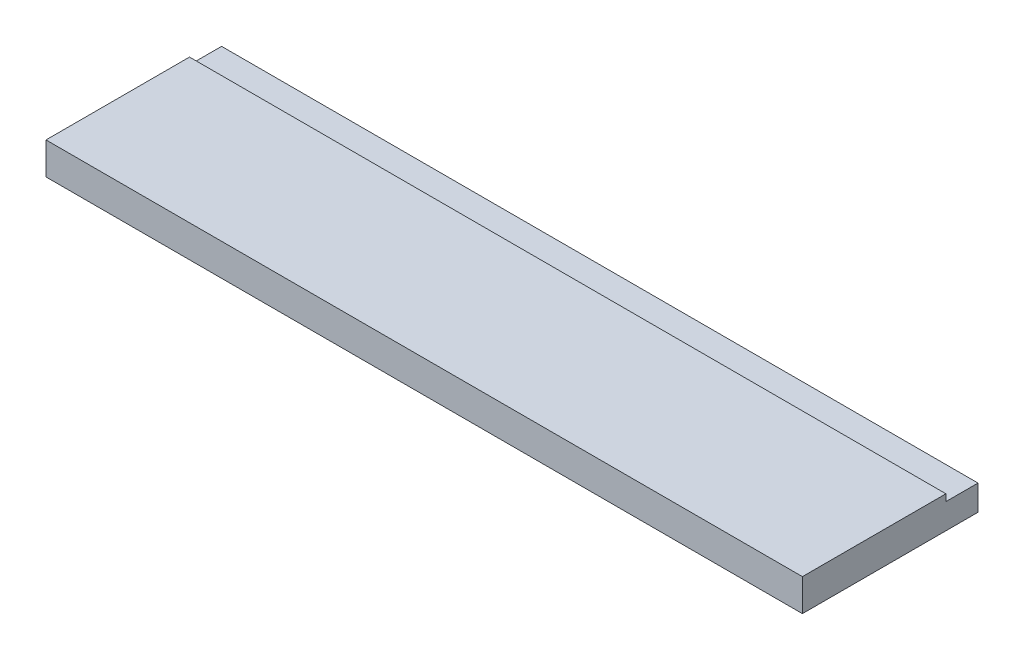
from build123d import *

# Parameters (mm, degrees)
SKETCH_1_W          = 224
SKETCH_1_H          = 52
EXTRUDE_1_DEPTH     = 9.5
SKETCH_2_W          = 224
SKETCH_2_H          = 9.5
CUT_EXTRUDE_1_DEPTH = 2


with BuildPart() as part:
    # 草图1 → 凸台-拉伸1 (new body)
    with BuildSketch(Plane(origin=(0, 0, 0), x_dir=(1, 0, 0), z_dir=(0, 1, 0))):
        with Locations((112, 26)):
            Rectangle(SKETCH_1_W, SKETCH_1_H)
    extrude(amount=EXTRUDE_1_DEPTH)

    # 草图2 → 切除-拉伸1 (cut)
    with BuildSketch(Plane(origin=(0, 9.5, 0), x_dir=(1, 0, 0), z_dir=(0, 1, 0))):
        with Locations((112, 47.25)):
            Rectangle(SKETCH_2_W, SKETCH_2_H)
    extrude(amount=-CUT_EXTRUDE_1_DEPTH, mode=Mode.SUBTRACT)


solid = part.part
